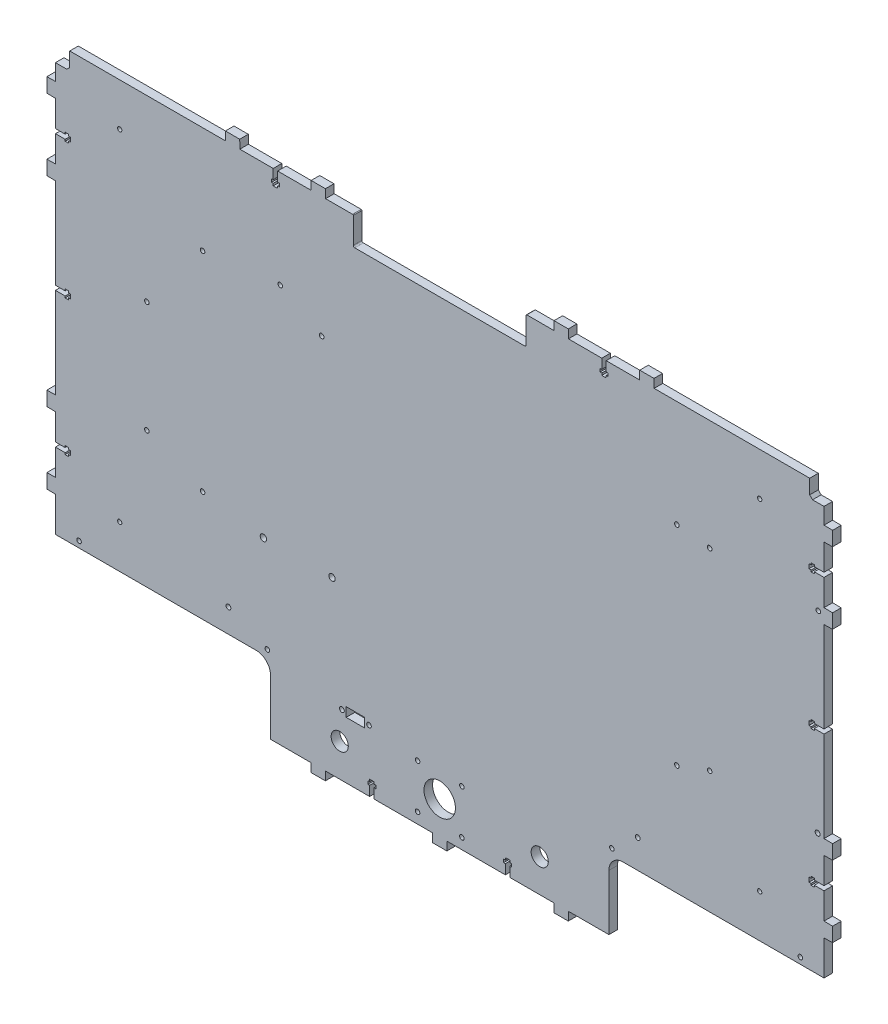
from build123d import *

# Parameters (mm, degrees)
SKETCH_1_R      = 1.6
SKETCH_1_R_2    = 1.5
SKETCH_1_R_3    = 1.7
SKETCH_1_R_4    = 6
SKETCH_1_W      = 13
SKETCH_1_H      = 6.5
SKETCH_1_R_5    = 1.626470027
SKETCH_1_R_6    = 2.25
SKETCH_1_R_7    = 11
SKETCH_1_R_8    = 1.75
EXTRUDE_1_DEPTH = 6


with BuildPart() as part:
    # Эскиз1 → Бобышка-Вытянуть1 (new body)
    with BuildSketch(Plane.XY):
        with BuildLine():
            Line((89.741925364, 539.042043616), (89.741925364, 500.137589553))
            Line((89.741925364, 500.137589553), (118.091925364, 500.137589553))
            Line((118.091925364, 500.137589553), (118.191925364, 494.137589553))
            Line((118.191925364, 494.137589553), (128.191925364, 494.137589553))
            Line((128.191925364, 494.137589553), (128.291925364, 500.137589553))
            Line((128.291925364, 500.137589553), (159.141925364, 500.137589553))
            Line((159.141925364, 500.137589553), (159.141925364, 506.937589553))
            Line((159.141925364, 506.937589553), (157.941925364, 506.937589553))
            Line((157.941925364, 506.937589553), (157.941925364, 509.137589553))
            Line((157.941925364, 509.137589553), (159.141925364, 509.137589553))
            Line((159.141925364, 509.137589553), (159.141925364, 510.637589553))
            Line((159.141925364, 510.637589553), (162.241925364, 510.637589553))
            Line((162.241925364, 510.637589553), (162.241925364, 509.137589553))
            Line((162.241925364, 509.137589553), (163.441925364, 509.137589553))
            Line((163.441925364, 509.137589553), (163.441925364, 506.937589553))
            Line((163.441925364, 506.937589553), (162.241925364, 506.937589553))
            Line((162.241925364, 506.937589553), (162.241925364, 500.137589553))
            Line((162.241925364, 500.137589553), (203.091925364, 500.137589553))
            Line((203.091925364, 500.137589553), (203.191925364, 494.137589553))
            Line((203.191925364, 494.137589553), (213.191925364, 494.137589553))
            Line((213.191925364, 494.137589553), (213.291925364, 500.137589553))
            Line((213.291925364, 500.137589553), (254.141925364, 500.137589553))
            Line((254.141925364, 500.137589553), (254.141925364, 506.937589553))
            Line((254.141925364, 506.937589553), (252.941925364, 506.937589553))
            Line((252.941925364, 506.937589553), (252.941925364, 509.137589553))
            Line((252.941925364, 509.137589553), (254.141925364, 509.137589553))
            Line((254.141925364, 509.137589553), (254.141925364, 510.637589553))
            Line((254.141925364, 510.637589553), (257.241925364, 510.637589553))
            Line((257.241925364, 510.637589553), (257.241925364, 509.137589553))
            Line((257.241925364, 509.137589553), (258.441925364, 509.137589553))
            Line((258.441925364, 509.137589553), (258.441925364, 506.937589553))
            Line((258.441925364, 506.937589553), (257.241925364, 506.937589553))
            Line((257.241925364, 506.937589553), (257.241925364, 500.137589553))
            Line((257.241925364, 500.137589553), (288.091925364, 500.137589553))
            Line((288.091925364, 500.137589553), (288.191925364, 494.137589553))
            Line((288.191925364, 494.137589553), (298.191925364, 494.137589553))
            Line((298.191925364, 494.137589553), (298.291925364, 500.137589553))
            Line((298.291925364, 500.137589553), (326.641925364, 500.137589553))
            Line((326.641925364, 500.137589553), (326.641925364, 539.137589553))
            ThreePointArc((326.641925364, 539.137589553), (329.570857552, 546.208657365), (336.641925364, 549.137589553))
            Line((336.641925364, 549.137589553), (377.191925364, 549.137589553))
            Line((377.191925364, 549.137589553), (477.191925364, 549.137589553))
            Line((477.191925364, 549.137589553), (477.191925364, 573.442043616))
            Line((477.191925364, 573.442043616), (483.191925364, 573.542043616))
            Line((483.191925364, 573.542043616), (483.191925364, 583.542043616))
            Line((483.191925364, 583.542043616), (477.191925364, 583.642043616))
            Line((477.191925364, 583.642043616), (477.191925364, 601.992043616))
            Line((477.191925364, 601.992043616), (470.391925364, 601.992043616))
            Line((470.391925364, 601.992043616), (470.391925364, 600.792043616))
            Line((470.391925364, 600.792043616), (468.191925364, 600.792043616))
            Line((468.191925364, 600.792043616), (468.191925364, 601.992043616))
            Line((468.191925364, 601.992043616), (466.691925364, 601.992043616))
            Line((466.691925364, 601.992043616), (466.691925364, 605.092043616))
            Line((466.691925364, 605.092043616), (468.191925364, 605.092043616))
            Line((468.191925364, 605.092043616), (468.191925364, 606.292043616))
            Line((468.191925364, 606.292043616), (470.391925364, 606.292043616))
            Line((470.391925364, 606.292043616), (470.391925364, 605.092043616))
            Line((470.391925364, 605.092043616), (477.191925364, 605.092043616))
            Line((477.191925364, 605.092043616), (477.191925364, 623.442043616))
            Line((477.191925364, 623.442043616), (483.191925364, 623.542043616))
            Line((483.191925364, 623.542043616), (483.191925364, 633.542043616))
            Line((483.191925364, 633.542043616), (477.191925364, 633.642043616))
            Line((477.191925364, 633.642043616), (477.191925364, 696.992043616))
            Line((477.191925364, 696.992043616), (470.391925364, 696.992043616))
            Line((470.391925364, 696.992043616), (470.391925364, 695.792043616))
            Line((470.391925364, 695.792043616), (468.191925364, 695.792043616))
            Line((468.191925364, 695.792043616), (468.191925364, 696.992043616))
            Line((468.191925364, 696.992043616), (466.691925364, 696.992043616))
            Line((466.691925364, 696.992043616), (466.691925364, 700.092043616))
            Line((466.691925364, 700.092043616), (468.191925364, 700.092043616))
            Line((468.191925364, 700.092043616), (468.191925364, 701.292043616))
            Line((468.191925364, 701.292043616), (470.391925364, 701.292043616))
            Line((470.391925364, 701.292043616), (470.391925364, 700.092043616))
            Line((470.391925364, 700.092043616), (477.191925364, 700.092043616))
            Line((477.191925364, 700.092043616), (477.191925364, 763.442043616))
            Line((477.191925364, 763.442043616), (483.191925364, 763.542043616))
            Line((483.191925364, 763.542043616), (483.191925364, 773.542043616))
            Line((483.191925364, 773.542043616), (477.191925364, 773.642043616))
            Line((477.191925364, 773.642043616), (477.191925364, 791.992043616))
            Line((477.191925364, 791.992043616), (470.391925364, 791.992043616))
            Line((470.391925364, 791.992043616), (470.391925364, 790.792043616))
            Line((470.391925364, 790.792043616), (468.191925364, 790.792043616))
            Line((468.191925364, 790.792043616), (468.191925364, 791.992043616))
            Line((468.191925364, 791.992043616), (466.691925364, 791.992043616))
            Line((466.691925364, 791.992043616), (466.691925364, 795.092043616))
            Line((466.691925364, 795.092043616), (468.191925364, 795.092043616))
            Line((468.191925364, 795.092043616), (468.191925364, 796.292043616))
            Line((468.191925364, 796.292043616), (470.391925364, 796.292043616))
            Line((470.391925364, 796.292043616), (470.391925364, 795.092043616))
            Line((470.391925364, 795.092043616), (477.191925364, 795.092043616))
            Line((477.191925364, 795.092043616), (477.191925364, 813.442043616))
            Line((477.191925364, 813.442043616), (483.191925364, 813.542043616))
            Line((483.191925364, 813.542043616), (483.191925364, 823.542043616))
            Line((483.191925364, 823.542043616), (477.191925364, 823.642043616))
            Line((477.191925364, 823.642043616), (477.191925364, 835.042043616))
            Line((477.191925364, 835.042043616), (469.191925364, 835.042043616))
            Line((469.191925364, 835.042043616), (467.191925364, 837.042043616))
            Line((467.191925364, 837.042043616), (467.191925364, 847.042043616))
            Line((467.191925364, 847.042043616), (467.191925364, 847.137589553))
            Line((467.191925364, 847.137589553), (367.191925364, 847.137589553))
            Line((367.191925364, 847.137589553), (358.291925364, 847.137589553))
            Line((358.291925364, 847.137589553), (358.191925364, 853.137589553))
            Line((358.191925364, 853.137589553), (348.191925364, 853.137589553))
            Line((348.191925364, 853.137589553), (348.091925364, 847.137589553))
            Line((348.091925364, 847.137589553), (324.741925364, 847.137589553))
            Line((324.741925364, 847.137589553), (324.741925364, 840.337589553))
            Line((324.741925364, 840.337589553), (325.941925364, 840.337589553))
            Line((325.941925364, 840.337589553), (325.941925364, 838.137589553))
            Line((325.941925364, 838.137589553), (324.741925364, 838.137589553))
            Line((324.741925364, 838.137589553), (324.741925364, 836.637589553))
            Line((324.741925364, 836.637589553), (321.641925364, 836.637589553))
            Line((321.641925364, 836.637589553), (321.641925364, 838.137589553))
            Line((321.641925364, 838.137589553), (320.441925364, 838.137589553))
            Line((320.441925364, 838.137589553), (320.441925364, 840.337589553))
            Line((320.441925364, 840.337589553), (321.641925364, 840.337589553))
            Line((321.641925364, 840.337589553), (321.641925364, 847.137589553))
            Line((321.641925364, 847.137589553), (298.291925364, 847.137589553))
            Line((298.291925364, 847.137589553), (298.191925364, 853.137589553))
            Line((298.191925364, 853.137589553), (288.191925364, 853.137589553))
            Line((288.191925364, 853.137589553), (288.091925364, 847.137589553))
            Line((288.091925364, 847.137589553), (269.191925364, 847.137589553))
            ThreePointArc((269.191925364, 847.137589553), (268.838371974, 846.991142943), (268.691925364, 846.637589553))
            Line((268.691925364, 846.637589553), (268.691925364, 828.542043616))
            ThreePointArc((268.691925364, 828.542043616), (268.399032145, 827.834936835), (267.691925364, 827.542043616))
            Line((267.691925364, 827.542043616), (148.691925364, 827.542043616))
            ThreePointArc((148.691925364, 827.542043616), (147.984818583, 827.834936835), (147.691925364, 828.542043616))
            Line((147.691925364, 828.542043616), (147.691925364, 846.542043616))
            Line((147.691925364, 846.542043616), (147.691925364, 846.637589553))
            ThreePointArc((147.691925364, 846.637589553), (147.545478755, 846.991142943), (147.191925364, 847.137589553))
            Line((147.191925364, 847.137589553), (128.291925364, 847.137589553))
            Line((128.291925364, 847.137589553), (128.191925364, 853.137589553))
            Line((128.191925364, 853.137589553), (118.191925364, 853.137589553))
            Line((118.191925364, 853.137589553), (118.091925364, 847.137589553))
            Line((118.091925364, 847.137589553), (94.741925364, 847.137589553))
            Line((94.741925364, 847.137589553), (94.741925364, 840.337589553))
            Line((94.741925364, 840.337589553), (95.941925364, 840.337589553))
            Line((95.941925364, 840.337589553), (95.941925364, 838.137589553))
            Line((95.941925364, 838.137589553), (94.741925364, 838.137589553))
            Line((94.741925364, 838.137589553), (94.741925364, 838.042043616))
            Line((94.741925364, 838.042043616), (94.741925364, 836.637589553))
            Line((94.741925364, 836.637589553), (94.741925364, 836.542043616))
            Line((94.741925364, 836.542043616), (91.641925364, 836.542043616))
            Line((91.641925364, 836.542043616), (91.641925364, 836.637589553))
            Line((91.641925364, 836.637589553), (91.641925364, 838.042043616))
            Line((91.641925364, 838.042043616), (91.641925364, 838.137589553))
            Line((91.641925364, 838.137589553), (90.441925364, 838.137589553))
            Line((90.441925364, 838.137589553), (90.441925364, 840.337589553))
            Line((90.441925364, 840.337589553), (91.641925364, 840.337589553))
            Line((91.641925364, 840.337589553), (91.641925364, 847.137589553))
            Line((91.641925364, 847.137589553), (68.291925364, 847.137589553))
            Line((68.291925364, 847.137589553), (68.191925364, 853.137589553))
            Line((68.191925364, 853.137589553), (58.191925364, 853.137589553))
            Line((58.191925364, 853.137589553), (58.091925364, 847.137589553))
            Line((58.091925364, 847.137589553), (49.191925364, 847.137589553))
            Line((49.191925364, 847.137589553), (-50.808074636, 847.137589553))
            Line((-50.808074636, 847.137589553), (-50.808074636, 847.042043616))
            Line((-50.808074636, 847.042043616), (-50.808074636, 837.042043616))
            Line((-50.808074636, 837.042043616), (-52.808074636, 835.042043616))
            Line((-52.808074636, 835.042043616), (-60.808074636, 835.042043616))
            Line((-60.808074636, 835.042043616), (-60.808074636, 823.642043616))
            Line((-60.808074636, 823.642043616), (-66.808074636, 823.542043616))
            Line((-66.808074636, 823.542043616), (-66.808074636, 813.542043616))
            Line((-66.808074636, 813.542043616), (-60.808074636, 813.442043616))
            Line((-60.808074636, 813.442043616), (-60.808074636, 795.092043616))
            Line((-60.808074636, 795.092043616), (-54.008074636, 795.092043616))
            Line((-54.008074636, 795.092043616), (-54.008074636, 796.292043616))
            Line((-54.008074636, 796.292043616), (-51.808074636, 796.292043616))
            Line((-51.808074636, 796.292043616), (-51.808074636, 795.092043616))
            Line((-51.808074636, 795.092043616), (-50.308074636, 795.092043616))
            Line((-50.308074636, 795.092043616), (-50.308074636, 791.992043616))
            Line((-50.308074636, 791.992043616), (-51.808074636, 791.992043616))
            Line((-51.808074636, 791.992043616), (-51.808074636, 790.792043616))
            Line((-51.808074636, 790.792043616), (-54.008074636, 790.792043616))
            Line((-54.008074636, 790.792043616), (-54.008074636, 791.992043616))
            Line((-54.008074636, 791.992043616), (-60.808074636, 791.992043616))
            Line((-60.808074636, 791.992043616), (-60.808074636, 773.642043616))
            Line((-60.808074636, 773.642043616), (-66.808074636, 773.542043616))
            Line((-66.808074636, 773.542043616), (-66.808074636, 763.542043616))
            Line((-66.808074636, 763.542043616), (-60.808074636, 763.442043616))
            Line((-60.808074636, 763.442043616), (-60.808074636, 700.092043616))
            Line((-60.808074636, 700.092043616), (-54.008074636, 700.092043616))
            Line((-54.008074636, 700.092043616), (-54.008074636, 701.292043616))
            Line((-54.008074636, 701.292043616), (-51.808074636, 701.292043616))
            Line((-51.808074636, 701.292043616), (-51.808074636, 700.092043616))
            Line((-51.808074636, 700.092043616), (-50.308074636, 700.092043616))
            Line((-50.308074636, 700.092043616), (-50.308074636, 696.992043616))
            Line((-50.308074636, 696.992043616), (-51.808074636, 696.992043616))
            Line((-51.808074636, 696.992043616), (-51.808074636, 695.792043616))
            Line((-51.808074636, 695.792043616), (-54.008074636, 695.792043616))
            Line((-54.008074636, 695.792043616), (-54.008074636, 696.992043616))
            Line((-54.008074636, 696.992043616), (-60.808074636, 696.992043616))
            Line((-60.808074636, 696.992043616), (-60.808074636, 633.642043616))
            Line((-60.808074636, 633.642043616), (-66.808074636, 633.542043616))
            Line((-66.808074636, 633.542043616), (-66.808074636, 623.542043616))
            Line((-66.808074636, 623.542043616), (-60.808074636, 623.442043616))
            Line((-60.808074636, 623.442043616), (-60.808074636, 605.092043616))
            Line((-60.808074636, 605.092043616), (-54.008074636, 605.092043616))
            Line((-54.008074636, 605.092043616), (-54.008074636, 606.292043616))
            Line((-54.008074636, 606.292043616), (-51.808074636, 606.292043616))
            Line((-51.808074636, 606.292043616), (-51.808074636, 605.092043616))
            Line((-51.808074636, 605.092043616), (-50.308074636, 605.092043616))
            Line((-50.308074636, 605.092043616), (-50.308074636, 601.992043616))
            Line((-50.308074636, 601.992043616), (-51.808074636, 601.992043616))
            Line((-51.808074636, 601.992043616), (-51.808074636, 600.792043616))
            Line((-51.808074636, 600.792043616), (-54.008074636, 600.792043616))
            Line((-54.008074636, 600.792043616), (-54.008074636, 601.992043616))
            Line((-54.008074636, 601.992043616), (-60.808074636, 601.992043616))
            Line((-60.808074636, 601.992043616), (-60.808074636, 583.642043616))
            Line((-60.808074636, 583.642043616), (-66.808074636, 583.542043616))
            Line((-66.808074636, 583.542043616), (-66.808074636, 573.542043616))
            Line((-66.808074636, 573.542043616), (-60.808074636, 573.442043616))
            Line((-60.808074636, 573.442043616), (-60.808074636, 549.042043616))
            Line((-60.808074636, 549.042043616), (39.191925364, 549.042043616))
            Line((39.191925364, 549.042043616), (79.741925364, 549.042043616))
            ThreePointArc((79.741925364, 549.042043616), (86.812993176, 546.113111428), (89.741925364, 539.042043616))
        make_face()
        with Locations((-44.258074636, 553.442043616)):
            Circle(SKETCH_1_R, mode=Mode.SUBTRACT)
        with Locations((-15.808074636, 579.137589553)):
            Circle(SKETCH_1_R_2, mode=Mode.SUBTRACT)
        with Locations((60.306923435, 565.643369962)):
            Circle(SKETCH_1_R_3, mode=Mode.SUBTRACT)
        with Locations((138.191925364, 523.137589553)):
            Circle(SKETCH_1_R_4, mode=Mode.SUBTRACT)
        with Locations((192.691925364, 507.637589553)):
            Circle(SKETCH_1_R, mode=Mode.SUBTRACT)
        with Locations((192.691925364, 538.637589553)):
            Circle(SKETCH_1_R, mode=Mode.SUBTRACT)
        with Locations((87.541925364, 553.442043616)):
            Circle(SKETCH_1_R, mode=Mode.SUBTRACT)
        with Locations((139.700153258, 543.137589553)):
            Circle(SKETCH_1_R_3, mode=Mode.SUBTRACT)
        with Locations((149.200153258, 543.147589553)):
            Rectangle(SKETCH_1_W, SKETCH_1_H, mode=Mode.SUBTRACT)
        with Locations((158.700153258, 543.137589553)):
            Circle(SKETCH_1_R_5, mode=Mode.SUBTRACT)
        with Locations((42.191925364, 626.492043616)):
            Circle(SKETCH_1_R, mode=Mode.SUBTRACT)
        with Locations((3.191925364, 644.137589553)):
            Circle(SKETCH_1_R, mode=Mode.SUBTRACT)
        with Locations((84.78568386, 619.788752578)):
            Circle(SKETCH_1_R_6, mode=Mode.SUBTRACT)
        with Locations((132.78568386, 619.788752578)):
            Circle(SKETCH_1_R_6, mode=Mode.SUBTRACT)
        with Locations((223.691925364, 507.637589553)):
            Circle(SKETCH_1_R, mode=Mode.SUBTRACT)
        with Locations((208.191925364, 523.137589553)):
            Circle(SKETCH_1_R_7, mode=Mode.SUBTRACT)
        with Locations((223.691925364, 538.637589553)):
            Circle(SKETCH_1_R, mode=Mode.SUBTRACT)
        with Locations((278.191925364, 523.137589553)):
            Circle(SKETCH_1_R_4, mode=Mode.SUBTRACT)
        with Locations((328.741925364, 553.537589553)):
            Circle(SKETCH_1_R, mode=Mode.SUBTRACT)
        with Locations((346.784706522, 569.071596444)):
            Circle(SKETCH_1_R_3, mode=Mode.SUBTRACT)
        with Locations((460.641925364, 553.537589553)):
            Circle(SKETCH_1_R, mode=Mode.SUBTRACT)
        with Locations((432.191925364, 579.137589553)):
            Circle(SKETCH_1_R_2, mode=Mode.SUBTRACT)
        with Locations((374.191925364, 626.492043616)):
            Circle(SKETCH_1_R, mode=Mode.SUBTRACT)
        with Locations((397.191925364, 634.750548648)):
            Circle(SKETCH_1_R, mode=Mode.SUBTRACT)
        with Locations((472.740614373, 634.750548648)):
            Circle(SKETCH_1_R_8, mode=Mode.SUBTRACT)
        with Locations((3.191925364, 722.137589553)):
            Circle(SKETCH_1_R, mode=Mode.SUBTRACT)
        with Locations((125.560359077, 762.493723785)):
            Circle(SKETCH_1_R, mode=Mode.SUBTRACT)
        with Locations((42.191925364, 772.492043616)):
            Circle(SKETCH_1_R, mode=Mode.SUBTRACT)
        with Locations((-15.808074636, 817.137589553)):
            Circle(SKETCH_1_R_2, mode=Mode.SUBTRACT)
        with Locations((96.560359077, 778.91114809)):
            Circle(SKETCH_1_R, mode=Mode.SUBTRACT)
        with Locations((374.191925364, 772.492043616)):
            Circle(SKETCH_1_R, mode=Mode.SUBTRACT)
        with Locations((397.191925364, 769.750548648)):
            Circle(SKETCH_1_R, mode=Mode.SUBTRACT)
        with Locations((473.191925364, 769.750548648)):
            Circle(SKETCH_1_R, mode=Mode.SUBTRACT)
        with Locations((432.191925364, 817.137589553)):
            Circle(SKETCH_1_R_2, mode=Mode.SUBTRACT)
    extrude(amount=EXTRUDE_1_DEPTH)


solid = part.part
